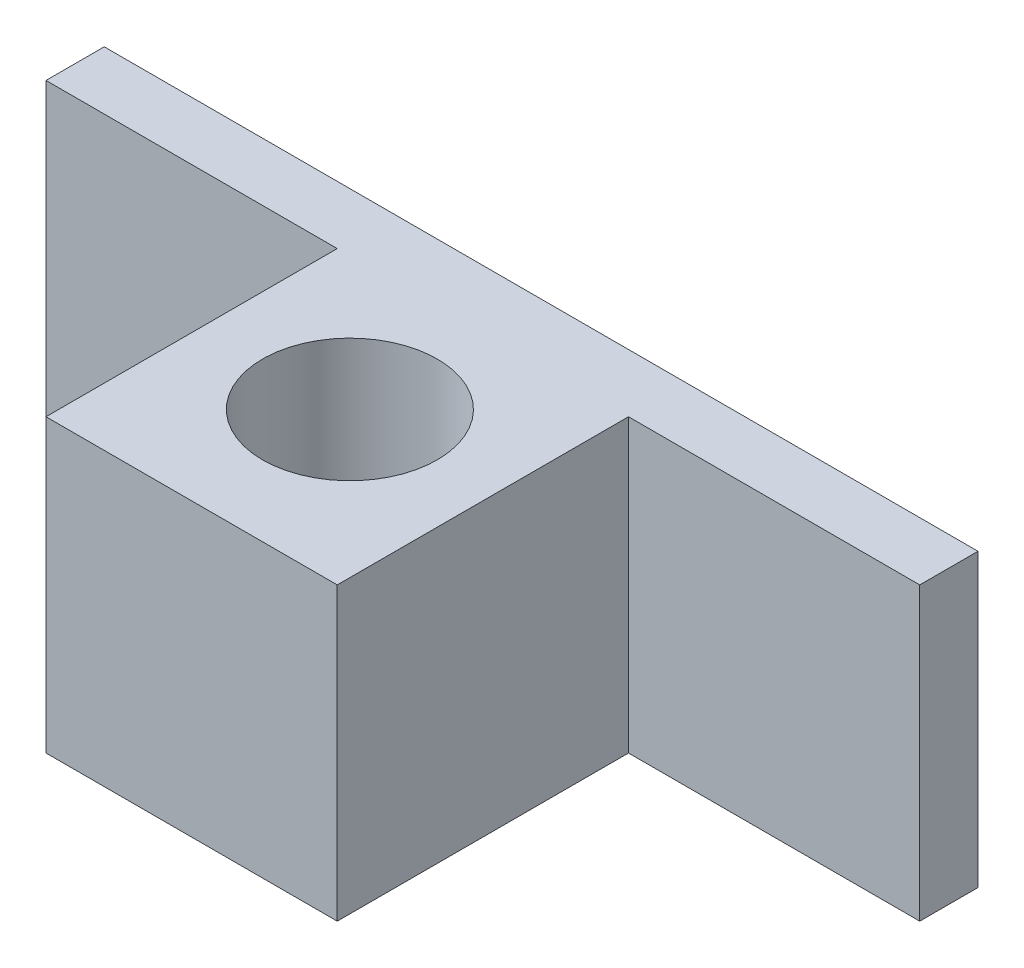
from build123d import *

# Parameters (mm, degrees)
SKETCH1_R           = 15
BOSS_EXTRUDE1_DEPTH = 25


with BuildPart() as part:
    # Sketch1 → Boss-Extrude1 (new, symmetric)
    with BuildSketch(Plane(origin=(0, 0, 0), x_dir=(-1, 0, 0), z_dir=(0, 1, 0))):
        Polygon((-75, 0), (75, 0), (75, 10), (25, 10), (25, 60), (-25, 60), (-25, 10), (-75, 10), align=None)
        with Locations((0, 32.828359868)):
            Circle(SKETCH1_R, mode=Mode.SUBTRACT)
    extrude(amount=BOSS_EXTRUDE1_DEPTH, both=True)


solid = part.part
